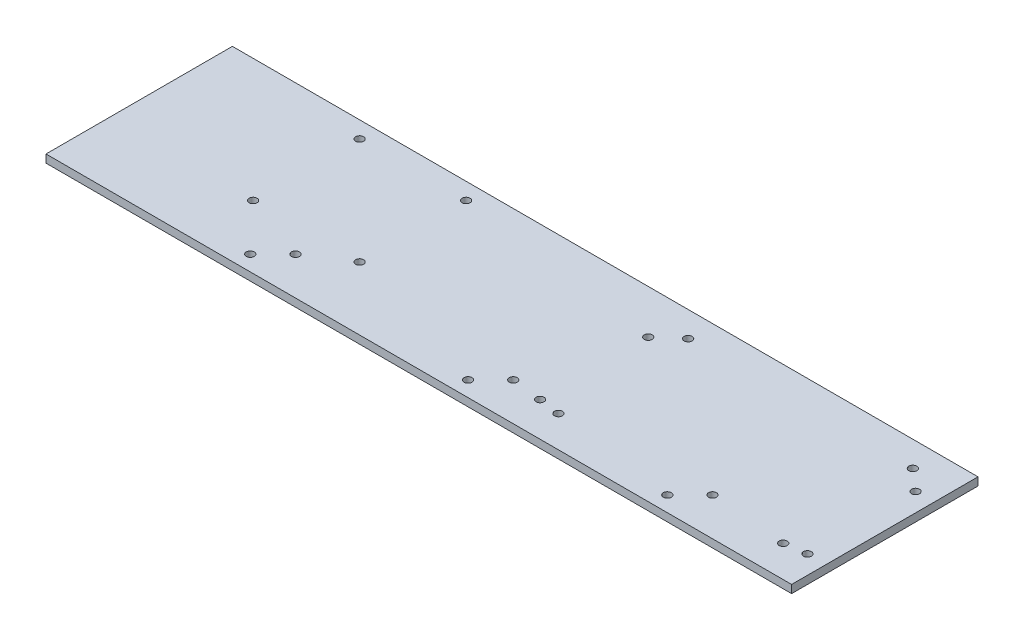
from build123d import *

# Parameters (mm, degrees)
SKETCH1_W           = 280
SKETCH1_H           = 70
SKETCH1_R           = 1.5
BOSS_EXTRUDE1_DEPTH = 3


with BuildPart() as part:
    # Sketch1 → Boss-Extrude1 (new body)
    with BuildSketch(Plane(origin=(0, 0, 0), x_dir=(1, 0, 0), z_dir=(0, 1, 0))):
        Rectangle(SKETCH1_W, SKETCH1_H)
        with Locations((87.571170369, -29.242640687)):
            Circle(SKETCH1_R, mode=Mode.SUBTRACT)
        with Locations((96.056451743, -20.757359313)):
            Circle(SKETCH1_R, mode=Mode.SUBTRACT)
        with Locations((32.64342059, 18.5)):
            Circle(SKETCH1_R, mode=Mode.SUBTRACT)
        with Locations((12.729398157, -29.242640687)):
            Circle(SKETCH1_R, mode=Mode.SUBTRACT)
        with Locations((21.214679531, -20.757359313)):
            Circle(SKETCH1_R, mode=Mode.SUBTRACT)
        with Locations((-60.567795503, -20.757359313)):
            Circle(SKETCH1_R, mode=Mode.SUBTRACT)
        with Locations((-69.053076877, -29.242640687)):
            Circle(SKETCH1_R, mode=Mode.SUBTRACT)
        with Locations((40.64342059, 25.5)):
            Circle(SKETCH1_R, mode=Mode.SUBTRACT)
        with Locations((32.64342059, -22.1)):
            Circle(SKETCH1_R, mode=Mode.SUBTRACT)
        with Locations((40.64342059, -23.2)):
            Circle(SKETCH1_R, mode=Mode.SUBTRACT)
        with Locations((125.04342059, -23.2)):
            Circle(SKETCH1_R, mode=Mode.SUBTRACT)
        with Locations((133.04342059, -22.1)):
            Circle(SKETCH1_R, mode=Mode.SUBTRACT)
        with Locations((133.04342059, 18.5)):
            Circle(SKETCH1_R, mode=Mode.SUBTRACT)
        with Locations((125.04342059, 25.5)):
            Circle(SKETCH1_R, mode=Mode.SUBTRACT)
        with Locations((-85.992560042, 28.748653915)):
            Circle(SKETCH1_R, mode=Mode.SUBTRACT)
        with Locations((-45.992560042, 28.748653915)):
            Circle(SKETCH1_R, mode=Mode.SUBTRACT)
        with Locations((-45.992560042, -11.251346085)):
            Circle(SKETCH1_R, mode=Mode.SUBTRACT)
        with Locations((-85.992560042, -11.251346085)):
            Circle(SKETCH1_R, mode=Mode.SUBTRACT)
    extrude(amount=BOSS_EXTRUDE1_DEPTH)


solid = part.part
